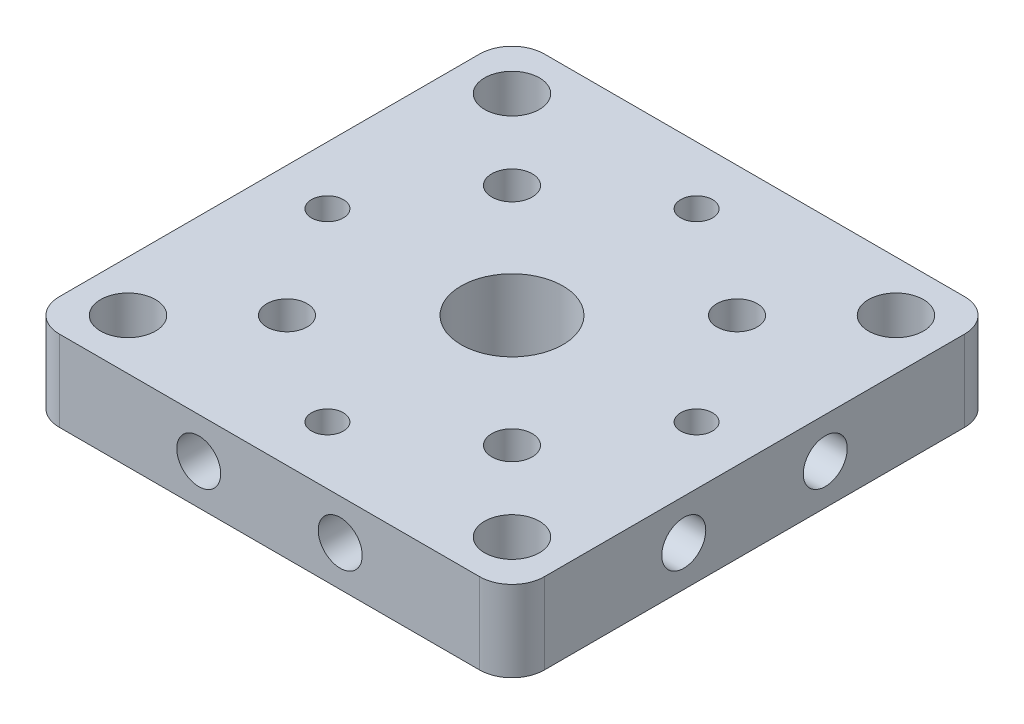
from build123d import *

# Parameters (mm, degrees)
SKETCH1_W           = 38.1
SKETCH1_H           = 38.1
SKETCH1_R           = 1.25
SKETCH1_R_2         = 1.5875
SKETCH1_R_3         = 4
BOSS_EXTRUDE1_DEPTH = 3.175
SKETCH4_R           = 1.7272
CUT_EXTRUDE2_DEPTH  = 9.525
SKETCH7_R           = 2.15265
CUT_EXTRUDE3_DEPTH  = 28.679008291
CIRPATTERN1_COUNT   = 4
SKETCH6_W           = 38.1
SKETCH6_H           = 38.1
SKETCH6_R           = 6.5
SKETCH6_R_2         = 2.15265
BOSS_EXTRUDE2_DEPTH = 3.175
FILLET1_R           = 2.54
FILLET2_R           = 2.54


with BuildPart() as part:
    # Sketch1 → Boss-Extrude1 (new, symmetric)
    with BuildSketch(Plane(origin=(0, 0, 0), x_dir=(1, 0, 0), z_dir=(0, 1, 0))):
        Rectangle(SKETCH1_W, SKETCH1_H)
        with Locations((0, -14.5)):
            Circle(SKETCH1_R, mode=Mode.SUBTRACT)
        with Locations((-8.838834765, -8.838834765)):
            Circle(SKETCH1_R_2, mode=Mode.SUBTRACT)
        with Locations((8.838834765, -8.838834765)):
            Circle(SKETCH1_R_2, mode=Mode.SUBTRACT)
        with Locations((-14.5, 0)):
            Circle(SKETCH1_R, mode=Mode.SUBTRACT)
        Circle(SKETCH1_R_3, mode=Mode.SUBTRACT)
        with Locations((-8.838834765, 8.838834765)):
            Circle(SKETCH1_R_2, mode=Mode.SUBTRACT)
        with Locations((0, 14.5)):
            Circle(SKETCH1_R, mode=Mode.SUBTRACT)
        with Locations((8.838834765, 8.838834765)):
            Circle(SKETCH1_R_2, mode=Mode.SUBTRACT)
        with Locations((14.5, 0)):
            Circle(SKETCH1_R, mode=Mode.SUBTRACT)
    extrude(amount=BOSS_EXTRUDE1_DEPTH, both=True)

    # Sketch4 → Cut-Extrude2 (cut)
    with BuildSketch(Plane.XY.offset(19.05)):
        with Locations((-5.55625, 0)):
            Circle(SKETCH4_R)
        with Locations((5.55625, 0)):
            Circle(SKETCH4_R)
    cut_extrude2 = extrude(amount=-CUT_EXTRUDE2_DEPTH, mode=Mode.SUBTRACT)

    # Sketch7 → Cut-Extrude3 (cut, through all)
    with BuildSketch(Plane.XZ.offset(3.175)):
        with Locations((-15.08125, 15.08125)):
            Circle(SKETCH7_R)
        with Locations((15.08125, 15.08125)):
            Circle(SKETCH7_R)
        with Locations((15.08125, -15.08125)):
            Circle(SKETCH7_R)
        with Locations((-15.08125, -15.08125)):
            Circle(SKETCH7_R)
    extrude(amount=-CUT_EXTRUDE3_DEPTH, mode=Mode.SUBTRACT)

    # CirPattern1: Cut-Extrude2 ×4 about axis
    cirpattern1_axis = Axis((0, 3.175, 0), (0, -1, 0))
    for i in range(1, CIRPATTERN1_COUNT):
        add(cut_extrude2.rotate(cirpattern1_axis, i * 360 / CIRPATTERN1_COUNT), mode=Mode.SUBTRACT)

    # Fillet1
    fillet1_edges = [part.edges().sort_by_distance(p)[0] for p in [
        (-19.05, 0, 19.05),
        (-19.05, 0, -19.05),
        (19.05, 0, -19.05),
        (19.05, 0, 19.05),
    ]]
    fillet(fillet1_edges, radius=FILLET1_R)


with BuildPart() as body_2:
    # Sketch6 → Boss-Extrude2 (new body)
    with BuildSketch(Plane(origin=(0, -33.3502, 0), x_dir=(-1, 0, 0), z_dir=(0, -1, 0))):
        Rectangle(SKETCH6_W, SKETCH6_H)
        Circle(SKETCH6_R, mode=Mode.SUBTRACT)
        with Locations((-15.08125, 15.08125)):
            Circle(SKETCH6_R_2, mode=Mode.SUBTRACT)
        with Locations((15.08125, 15.08125)):
            Circle(SKETCH6_R_2, mode=Mode.SUBTRACT)
        with Locations((15.08125, -15.08125)):
            Circle(SKETCH6_R_2, mode=Mode.SUBTRACT)
        with Locations((-15.08125, -15.08125)):
            Circle(SKETCH6_R_2, mode=Mode.SUBTRACT)
    extrude(amount=BOSS_EXTRUDE2_DEPTH)

    # Fillet2
    fillet2_edges = [body_2.edges().sort_by_distance(p)[0] for p in [
        (-19.05, -34.9377, 19.05),
        (-19.05, -34.9377, -19.05),
        (19.05, -34.9377, -19.05),
        (19.05, -34.9377, 19.05),
    ]]
    fillet(fillet2_edges, radius=FILLET2_R)


solid = part.part
